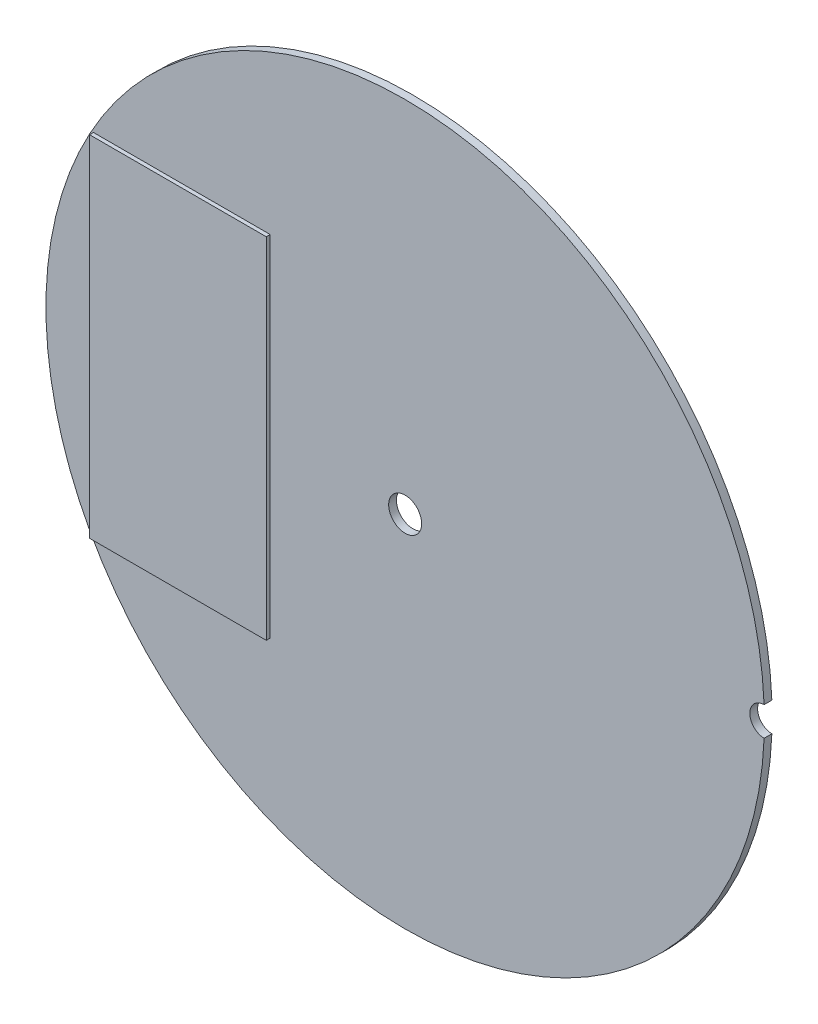
from build123d import *

# Parameters (mm, degrees)
ESQUISSE1_R        = 0.85
BOSS_EXTRU_1_DEPTH = 0.4
ESQUISSE2_W        = 9.1
ESQUISSE2_H        = 18
BOSS_EXTRU_2_DEPTH = 0.2


with BuildPart() as part:
    # Esquisse1 → Boss.-Extru.1 (new body)
    with BuildSketch(Plane.XY):
        with BuildLine():
            ThreePointArc((18.484797297, 0.749845903), (-18.5, 0), (18.484797297, -0.749845903))
            ThreePointArc((18.484797297, -0.749845903), (17.75, 0), (18.484797297, 0.749845903))
        make_face()
        Circle(ESQUISSE1_R, mode=Mode.SUBTRACT)
        with BuildLine():
            Line((-14.5, -4.5), (-14.5, 4.5))
            ThreePointArc((-14.5, 4.5), (-11.5, 7.5), (-8.5, 4.5))
            Line((-8.5, 4.5), (-8.5, -4.5))
            ThreePointArc((-8.5, -4.5), (-11.5, -7.5), (-14.5, -4.5))
        make_face(mode=Mode.SUBTRACT)
    extrude(amount=BOSS_EXTRU_1_DEPTH)

    # Esquisse2 → Boss.-Extru.2 (add)
    with BuildSketch(Plane.XY.offset(0.4)):
        with Locations((-11.5, 0)):
            Rectangle(ESQUISSE2_W, ESQUISSE2_H)
    extrude(amount=BOSS_EXTRU_2_DEPTH)


solid = part.part
